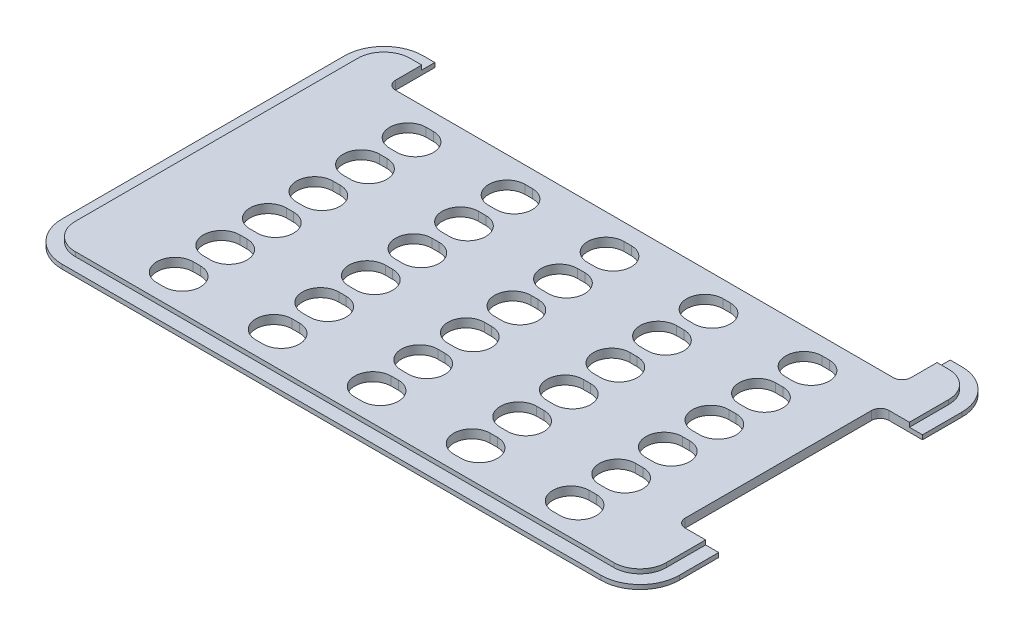
from build123d import *

# Parameters (mm, degrees)
SKETCH1_W                    = 212
SKETCH1_H                    = 124
OUTER_PROFILE_DEPTH          = 1.5
SKETCH2_W                    = 203
SKETCH2_H                    = 115
INNER_PROFILE_DEPTH          = 1.5
FILLET1_R                    = 9
FILLET2_R                    = 13.5
SKETCH4_W                    = 177
SKETCH4_H                    = 16.5
SKETCH4_W_2                  = 14.5
SKETCH4_H_2                  = 70
MESSAGE_BAR_DEPTH            = 123.837290755
CUTOUT_DEPTH                 = 123.837290755
CUTOUTS_COUNT                = 3
CUTOUTS_PITCH                = 34
CUTOUTS_COUNT_DIR2           = 6
CUTOUTS_PITCH_DIR2           = 16
MIRROR_CUTOUTS_COPY_1_DEPTH  = 123.837290755
MIRROR_CUTOUTS_COPY_2_DEPTH  = 123.837290755
MIRROR_CUTOUTS_COPY_3_DEPTH  = 123.837290755
MIRROR_CUTOUTS_COPY_4_DEPTH  = 123.837290755
MIRROR_CUTOUTS_COPY_5_DEPTH  = 123.837290755
MIRROR_CUTOUTS_COPY_6_DEPTH  = 123.837290755
MIRROR_CUTOUTS_COPY_7_DEPTH  = 123.837290755
MIRROR_CUTOUTS_COPY_8_DEPTH  = 123.837290755
MIRROR_CUTOUTS_COPY_9_DEPTH  = 123.837290755
MIRROR_CUTOUTS_COPY_10_DEPTH = 123.837290755
MIRROR_CUTOUTS_COPY_11_DEPTH = 123.837290755
MIRROR_CUTOUTS_COPY_12_DEPTH = 123.837290755
MIRROR_CUTOUTS_COPY_13_DEPTH = 123.837290755
MIRROR_CUTOUTS_COPY_14_DEPTH = 123.837290755
MIRROR_CUTOUTS_COPY_15_DEPTH = 123.837290755
MIRROR_CUTOUTS_COPY_16_DEPTH = 123.837290755
MIRROR_CUTOUTS_COPY_17_DEPTH = 123.837290755
MIRROR_CUTOUTS_COPY_18_DEPTH = 123.837290755
CORNER_RAD_R                 = 3


with BuildPart() as part:
    # Sketch1 → Outer Profile (new body)
    with BuildSketch(Plane(origin=(0, 0, 0), x_dir=(1, 0, 0), z_dir=(0, 1, 0))):
        Rectangle(SKETCH1_W, SKETCH1_H)
    extrude(amount=OUTER_PROFILE_DEPTH)

    # Sketch2 → Inner Profile (add)
    with BuildSketch(Plane(origin=(0, 1.5, 0), x_dir=(1, 0, 0), z_dir=(0, 1, 0))):
        Rectangle(SKETCH2_W, SKETCH2_H)
    extrude(amount=INNER_PROFILE_DEPTH)

    # Fillet1
    fillet1_edges = [part.edges().sort_by_distance(p)[0] for p in [
        (101.5, 2.25, 57.5),
        (101.5, 2.25, -57.5),
        (-101.5, 2.25, -57.5),
        (-101.5, 2.25, 57.5),
    ]]
    fillet(fillet1_edges, radius=FILLET1_R)

    # Fillet2
    fillet2_edges = [part.edges().sort_by_distance(p)[0] for p in [
        (-106, 0.75, -62),
        (106, 0.75, -62),
        (106, 0.75, 62),
        (-106, 0.75, 62),
    ]]
    fillet(fillet2_edges, radius=FILLET2_R)

    # Sketch4 → Message Bar (cut, through all)
    with BuildSketch(Plane(origin=(0, 3, 0), x_dir=(1, 0, 0), z_dir=(0, 1, 0))):
        with Locations((0, 53.75)):
            Rectangle(SKETCH4_W, SKETCH4_H)
        with Locations((98.75, 0)):
            Rectangle(SKETCH4_W_2, SKETCH4_H_2)
    extrude(amount=-MESSAGE_BAR_DEPTH, mode=Mode.SUBTRACT)

    # Sketch5 → Cutout (cut, through all)
    with BuildSketch(Plane(origin=(0, 3, 0), x_dir=(1, 0, 0), z_dir=(0, 1, 0))):
        with BuildLine():
            Line((-1.25, -40.25), (1.25, -40.25))
            ThreePointArc((1.25, -40.25), (7.5, -46.5), (1.25, -52.75))
            Line((1.25, -52.75), (-1.25, -52.75))
            ThreePointArc((-1.25, -52.75), (-7.5, -46.5), (-1.25, -40.25))
        make_face()
    cutout = extrude(amount=-CUTOUT_DEPTH, mode=Mode.SUBTRACT)

    # Cutouts: Cutout 3 × 6
    with Locations(*[(-i * CUTOUTS_PITCH, 0, -j * CUTOUTS_PITCH_DIR2) for i in range(CUTOUTS_COUNT) for j in range(CUTOUTS_COUNT_DIR2) if (i, j) != (0, 0)]):
        add(cutout, mode=Mode.SUBTRACT)

    # Mirror Cutouts copy 1 sketch → Mirror Cutouts copy 1 (cut, through all)
    with BuildSketch(Plane(origin=(0, 3, -16), x_dir=(-1, 0, 0), z_dir=(0, 1, 0))):
        with BuildLine():
            Line((-1.25, 40.25), (1.25, 40.25))
            ThreePointArc((1.25, 40.25), (7.5, 46.5), (1.25, 52.75))
            Line((1.25, 52.75), (-1.25, 52.75))
            ThreePointArc((-1.25, 52.75), (-7.5, 46.5), (-1.25, 40.25))
        make_face()
    extrude(amount=-MIRROR_CUTOUTS_COPY_1_DEPTH, mode=Mode.SUBTRACT)

    # Mirror Cutouts copy 2 sketch → Mirror Cutouts copy 2 (cut, through all)
    with BuildSketch(Plane(origin=(0, 3, -32), x_dir=(-1, 0, 0), z_dir=(0, 1, 0))):
        with BuildLine():
            Line((-1.25, 40.25), (1.25, 40.25))
            ThreePointArc((1.25, 40.25), (7.5, 46.5), (1.25, 52.75))
            Line((1.25, 52.75), (-1.25, 52.75))
            ThreePointArc((-1.25, 52.75), (-7.5, 46.5), (-1.25, 40.25))
        make_face()
    extrude(amount=-MIRROR_CUTOUTS_COPY_2_DEPTH, mode=Mode.SUBTRACT)

    # Mirror Cutouts copy 3 sketch → Mirror Cutouts copy 3 (cut, through all)
    with BuildSketch(Plane(origin=(0, 3, -48), x_dir=(-1, 0, 0), z_dir=(0, 1, 0))):
        with BuildLine():
            Line((-1.25, 40.25), (1.25, 40.25))
            ThreePointArc((1.25, 40.25), (7.5, 46.5), (1.25, 52.75))
            Line((1.25, 52.75), (-1.25, 52.75))
            ThreePointArc((-1.25, 52.75), (-7.5, 46.5), (-1.25, 40.25))
        make_face()
    extrude(amount=-MIRROR_CUTOUTS_COPY_3_DEPTH, mode=Mode.SUBTRACT)

    # Mirror Cutouts copy 4 sketch → Mirror Cutouts copy 4 (cut, through all)
    with BuildSketch(Plane(origin=(0, 3, -64), x_dir=(-1, 0, 0), z_dir=(0, 1, 0))):
        with BuildLine():
            Line((-1.25, 40.25), (1.25, 40.25))
            ThreePointArc((1.25, 40.25), (7.5, 46.5), (1.25, 52.75))
            Line((1.25, 52.75), (-1.25, 52.75))
            ThreePointArc((-1.25, 52.75), (-7.5, 46.5), (-1.25, 40.25))
        make_face()
    extrude(amount=-MIRROR_CUTOUTS_COPY_4_DEPTH, mode=Mode.SUBTRACT)

    # Mirror Cutouts copy 5 sketch → Mirror Cutouts copy 5 (cut, through all)
    with BuildSketch(Plane(origin=(0, 3, -80), x_dir=(-1, 0, 0), z_dir=(0, 1, 0))):
        with BuildLine():
            Line((-1.25, 40.25), (1.25, 40.25))
            ThreePointArc((1.25, 40.25), (7.5, 46.5), (1.25, 52.75))
            Line((1.25, 52.75), (-1.25, 52.75))
            ThreePointArc((-1.25, 52.75), (-7.5, 46.5), (-1.25, 40.25))
        make_face()
    extrude(amount=-MIRROR_CUTOUTS_COPY_5_DEPTH, mode=Mode.SUBTRACT)

    # Mirror Cutouts copy 6 sketch → Mirror Cutouts copy 6 (cut, through all)
    with BuildSketch(Plane(origin=(34, 3, 0), x_dir=(-1, 0, 0), z_dir=(0, 1, 0))):
        with BuildLine():
            Line((-1.25, 40.25), (1.25, 40.25))
            ThreePointArc((1.25, 40.25), (7.5, 46.5), (1.25, 52.75))
            Line((1.25, 52.75), (-1.25, 52.75))
            ThreePointArc((-1.25, 52.75), (-7.5, 46.5), (-1.25, 40.25))
        make_face()
    extrude(amount=-MIRROR_CUTOUTS_COPY_6_DEPTH, mode=Mode.SUBTRACT)

    # Mirror Cutouts copy 7 sketch → Mirror Cutouts copy 7 (cut, through all)
    with BuildSketch(Plane(origin=(34, 3, -16), x_dir=(-1, 0, 0), z_dir=(0, 1, 0))):
        with BuildLine():
            Line((-1.25, 40.25), (1.25, 40.25))
            ThreePointArc((1.25, 40.25), (7.5, 46.5), (1.25, 52.75))
            Line((1.25, 52.75), (-1.25, 52.75))
            ThreePointArc((-1.25, 52.75), (-7.5, 46.5), (-1.25, 40.25))
        make_face()
    extrude(amount=-MIRROR_CUTOUTS_COPY_7_DEPTH, mode=Mode.SUBTRACT)

    # Mirror Cutouts copy 8 sketch → Mirror Cutouts copy 8 (cut, through all)
    with BuildSketch(Plane(origin=(34, 3, -32), x_dir=(-1, 0, 0), z_dir=(0, 1, 0))):
        with BuildLine():
            Line((-1.25, 40.25), (1.25, 40.25))
            ThreePointArc((1.25, 40.25), (7.5, 46.5), (1.25, 52.75))
            Line((1.25, 52.75), (-1.25, 52.75))
            ThreePointArc((-1.25, 52.75), (-7.5, 46.5), (-1.25, 40.25))
        make_face()
    extrude(amount=-MIRROR_CUTOUTS_COPY_8_DEPTH, mode=Mode.SUBTRACT)

    # Mirror Cutouts copy 9 sketch → Mirror Cutouts copy 9 (cut, through all)
    with BuildSketch(Plane(origin=(34, 3, -48), x_dir=(-1, 0, 0), z_dir=(0, 1, 0))):
        with BuildLine():
            Line((-1.25, 40.25), (1.25, 40.25))
            ThreePointArc((1.25, 40.25), (7.5, 46.5), (1.25, 52.75))
            Line((1.25, 52.75), (-1.25, 52.75))
            ThreePointArc((-1.25, 52.75), (-7.5, 46.5), (-1.25, 40.25))
        make_face()
    extrude(amount=-MIRROR_CUTOUTS_COPY_9_DEPTH, mode=Mode.SUBTRACT)

    # Mirror Cutouts copy 10 sketch → Mirror Cutouts copy 10 (cut, through all)
    with BuildSketch(Plane(origin=(34, 3, -64), x_dir=(-1, 0, 0), z_dir=(0, 1, 0))):
        with BuildLine():
            Line((-1.25, 40.25), (1.25, 40.25))
            ThreePointArc((1.25, 40.25), (7.5, 46.5), (1.25, 52.75))
            Line((1.25, 52.75), (-1.25, 52.75))
            ThreePointArc((-1.25, 52.75), (-7.5, 46.5), (-1.25, 40.25))
        make_face()
    extrude(amount=-MIRROR_CUTOUTS_COPY_10_DEPTH, mode=Mode.SUBTRACT)

    # Mirror Cutouts copy 11 sketch → Mirror Cutouts copy 11 (cut, through all)
    with BuildSketch(Plane(origin=(34, 3, -80), x_dir=(-1, 0, 0), z_dir=(0, 1, 0))):
        with BuildLine():
            Line((-1.25, 40.25), (1.25, 40.25))
            ThreePointArc((1.25, 40.25), (7.5, 46.5), (1.25, 52.75))
            Line((1.25, 52.75), (-1.25, 52.75))
            ThreePointArc((-1.25, 52.75), (-7.5, 46.5), (-1.25, 40.25))
        make_face()
    extrude(amount=-MIRROR_CUTOUTS_COPY_11_DEPTH, mode=Mode.SUBTRACT)

    # Mirror Cutouts copy 12 sketch → Mirror Cutouts copy 12 (cut, through all)
    with BuildSketch(Plane(origin=(68, 3, 0), x_dir=(-1, 0, 0), z_dir=(0, 1, 0))):
        with BuildLine():
            Line((-1.25, 40.25), (1.25, 40.25))
            ThreePointArc((1.25, 40.25), (7.5, 46.5), (1.25, 52.75))
            Line((1.25, 52.75), (-1.25, 52.75))
            ThreePointArc((-1.25, 52.75), (-7.5, 46.5), (-1.25, 40.25))
        make_face()
    extrude(amount=-MIRROR_CUTOUTS_COPY_12_DEPTH, mode=Mode.SUBTRACT)

    # Mirror Cutouts copy 13 sketch → Mirror Cutouts copy 13 (cut, through all)
    with BuildSketch(Plane(origin=(68, 3, -16), x_dir=(-1, 0, 0), z_dir=(0, 1, 0))):
        with BuildLine():
            Line((-1.25, 40.25), (1.25, 40.25))
            ThreePointArc((1.25, 40.25), (7.5, 46.5), (1.25, 52.75))
            Line((1.25, 52.75), (-1.25, 52.75))
            ThreePointArc((-1.25, 52.75), (-7.5, 46.5), (-1.25, 40.25))
        make_face()
    extrude(amount=-MIRROR_CUTOUTS_COPY_13_DEPTH, mode=Mode.SUBTRACT)

    # Mirror Cutouts copy 14 sketch → Mirror Cutouts copy 14 (cut, through all)
    with BuildSketch(Plane(origin=(68, 3, -32), x_dir=(-1, 0, 0), z_dir=(0, 1, 0))):
        with BuildLine():
            Line((-1.25, 40.25), (1.25, 40.25))
            ThreePointArc((1.25, 40.25), (7.5, 46.5), (1.25, 52.75))
            Line((1.25, 52.75), (-1.25, 52.75))
            ThreePointArc((-1.25, 52.75), (-7.5, 46.5), (-1.25, 40.25))
        make_face()
    extrude(amount=-MIRROR_CUTOUTS_COPY_14_DEPTH, mode=Mode.SUBTRACT)

    # Mirror Cutouts copy 15 sketch → Mirror Cutouts copy 15 (cut, through all)
    with BuildSketch(Plane(origin=(68, 3, -48), x_dir=(-1, 0, 0), z_dir=(0, 1, 0))):
        with BuildLine():
            Line((-1.25, 40.25), (1.25, 40.25))
            ThreePointArc((1.25, 40.25), (7.5, 46.5), (1.25, 52.75))
            Line((1.25, 52.75), (-1.25, 52.75))
            ThreePointArc((-1.25, 52.75), (-7.5, 46.5), (-1.25, 40.25))
        make_face()
    extrude(amount=-MIRROR_CUTOUTS_COPY_15_DEPTH, mode=Mode.SUBTRACT)

    # Mirror Cutouts copy 16 sketch → Mirror Cutouts copy 16 (cut, through all)
    with BuildSketch(Plane(origin=(68, 3, -64), x_dir=(-1, 0, 0), z_dir=(0, 1, 0))):
        with BuildLine():
            Line((-1.25, 40.25), (1.25, 40.25))
            ThreePointArc((1.25, 40.25), (7.5, 46.5), (1.25, 52.75))
            Line((1.25, 52.75), (-1.25, 52.75))
            ThreePointArc((-1.25, 52.75), (-7.5, 46.5), (-1.25, 40.25))
        make_face()
    extrude(amount=-MIRROR_CUTOUTS_COPY_16_DEPTH, mode=Mode.SUBTRACT)

    # Mirror Cutouts copy 17 sketch → Mirror Cutouts copy 17 (cut, through all)
    with BuildSketch(Plane(origin=(68, 3, -80), x_dir=(-1, 0, 0), z_dir=(0, 1, 0))):
        with BuildLine():
            Line((-1.25, 40.25), (1.25, 40.25))
            ThreePointArc((1.25, 40.25), (7.5, 46.5), (1.25, 52.75))
            Line((1.25, 52.75), (-1.25, 52.75))
            ThreePointArc((-1.25, 52.75), (-7.5, 46.5), (-1.25, 40.25))
        make_face()
    extrude(amount=-MIRROR_CUTOUTS_COPY_17_DEPTH, mode=Mode.SUBTRACT)

    # Mirror Cutouts copy 18 sketch → Mirror Cutouts copy 18 (cut, through all)
    with BuildSketch(Plane(origin=(0, 3, 0), x_dir=(-1, 0, 0), z_dir=(0, 1, 0))):
        with BuildLine():
            Line((-1.25, 40.25), (1.25, 40.25))
            ThreePointArc((1.25, 40.25), (7.5, 46.5), (1.25, 52.75))
            Line((1.25, 52.75), (-1.25, 52.75))
            ThreePointArc((-1.25, 52.75), (-7.5, 46.5), (-1.25, 40.25))
        make_face()
    extrude(amount=-MIRROR_CUTOUTS_COPY_18_DEPTH, mode=Mode.SUBTRACT)

    # Corner Rad
    corner_rad_edges = [part.edges().sort_by_distance(p)[0] for p in [
        (88.5, 1.5, -45.5),
        (-88.5, 1.5, -45.5),
        (91.5, 1.5, 35),
        (91.5, 1.5, -35),
    ]]
    fillet(corner_rad_edges, radius=CORNER_RAD_R)


solid = part.part
